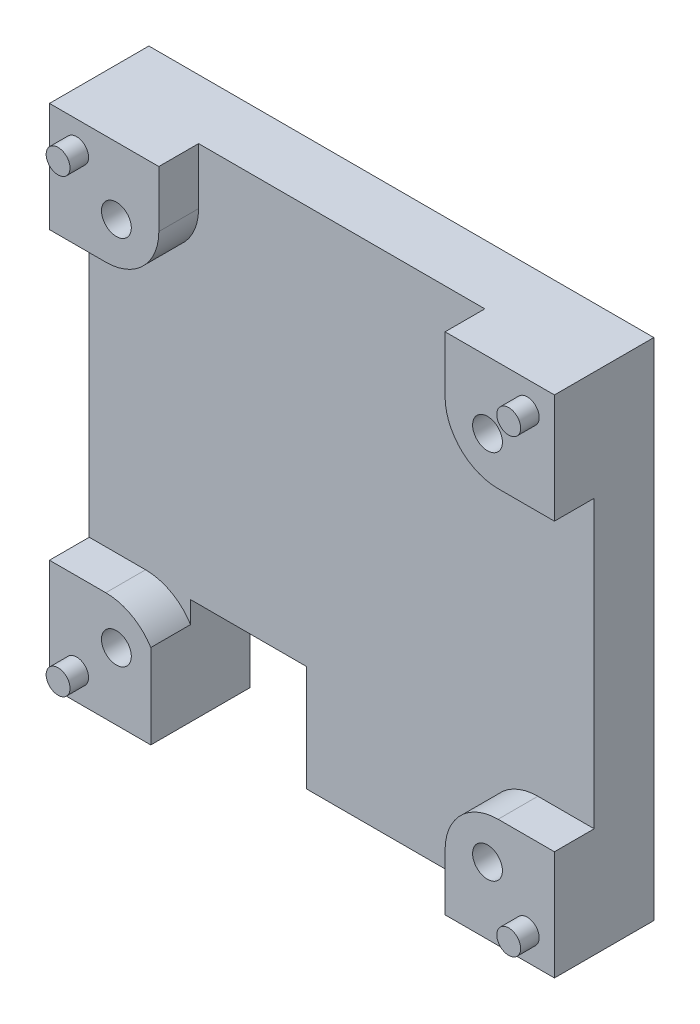
from build123d import *

# Parameters (mm, degrees)
SKETCH3_W           = 38.1
SKETCH3_H           = 38.1
SKETCH3_R           = 1.125
BOSS_EXTRUDE1_DEPTH = 4.5
BOSS_EXTRUDE2_START = 3
SKETCH2_R           = 1.125
BOSS_EXTRUDE2_DEPTH = 3
SKETCH4_W           = 8.75
SKETCH4_H           = 5.25
CUT_EXTRUDE1_DEPTH  = 10
SKETCH6_W           = 8.75
SKETCH6_H           = 2.75
CUT_EXTRUDE2_DEPTH  = 10
SKETCH7_R           = 0.9
BOSS_EXTRUDE3_DEPTH = 1.4


with BuildPart() as part:
    # Sketch3 → Boss-Extrude1 (new body)
    with BuildSketch(Plane.XY):
        with Locations((0.466348003, 11.564505911)):
            Rectangle(SKETCH3_W, SKETCH3_H)
        with Locations((-13.533651997, 25.564505911)):
            Circle(SKETCH3_R, mode=Mode.SUBTRACT)
        with Locations((14.466348003, 25.564505911)):
            Circle(SKETCH3_R, mode=Mode.SUBTRACT)
        with Locations((14.466348003, -2.435494089)):
            Circle(SKETCH3_R, mode=Mode.SUBTRACT)
        with Locations((-13.533651997, -2.435494089)):
            Circle(SKETCH3_R, mode=Mode.SUBTRACT)
    extrude(amount=-BOSS_EXTRUDE1_DEPTH)

    # Sketch2 → Boss-Extrude2 (add)
    # profile 1 of 4: a face of its own
    with BuildSketch(Plane.XY.offset(BOSS_EXTRUDE2_START)):
        with BuildLine():
            Line((-18.583651997, 30.614505911), (-10.333651997, 30.614505911))
            Line((-10.333651997, 30.614505911), (-10.333651997, 26.364505911))
            ThreePointArc((-10.333651997, 26.364505911), (-11.505224872, 23.536078787), (-14.333651997, 22.364505911))
            Line((-14.333651997, 22.364505911), (-18.583651997, 22.364505911))
            Line((-18.583651997, 22.364505911), (-18.583651997, 30.614505911))
        make_face()
        with Locations((-13.533651997, 25.564505911)):
            Circle(SKETCH2_R, mode=Mode.SUBTRACT)
    # profile 2 of 4: a face of its own
    with BuildSketch(Plane.XY.offset(BOSS_EXTRUDE2_START)):
        with BuildLine():
            Line((19.516348003, 30.614505911), (11.266348003, 30.614505911))
            Line((11.266348003, 30.614505911), (11.266348003, 26.364505911))
            ThreePointArc((11.266348003, 26.364505911), (12.437920878, 23.536078787), (15.266348003, 22.364505911))
            Line((15.266348003, 22.364505911), (19.516348003, 22.364505911))
            Line((19.516348003, 22.364505911), (19.516348003, 30.614505911))
        make_face()
        with Locations((14.466348003, 25.564505911)):
            Circle(SKETCH2_R, mode=Mode.SUBTRACT)
    # profile 3 of 4: a face of its own
    with BuildSketch(Plane.XY.offset(BOSS_EXTRUDE2_START)):
        with BuildLine():
            Line((19.516348003, -7.485494089), (11.266348003, -7.485494089))
            Line((11.266348003, -7.485494089), (11.266348003, -3.235494089))
            ThreePointArc((11.266348003, -3.235494089), (12.437920878, -0.407066964), (15.266348003, 0.764505911))
            Line((15.266348003, 0.764505911), (19.516348003, 0.764505911))
            Line((19.516348003, 0.764505911), (19.516348003, -7.485494089))
        make_face()
        with Locations((14.466348003, -2.435494089)):
            Circle(SKETCH2_R, mode=Mode.SUBTRACT)
    # profile 4 of 4: a face of its own
    with BuildSketch(Plane.XY.offset(BOSS_EXTRUDE2_START)):
        with BuildLine():
            Line((-18.583651997, -7.485494089), (-10.333651997, -7.485494089))
            Line((-10.333651997, -7.485494089), (-10.333651997, -3.235494089))
            ThreePointArc((-10.333651997, -3.235494089), (-11.505224872, -0.407066964), (-14.333651997, 0.764505911))
            Line((-14.333651997, 0.764505911), (-18.583651997, 0.764505911))
            Line((-18.583651997, 0.764505911), (-18.583651997, -7.485494089))
        make_face()
        with Locations((-13.533651997, -2.435494089)):
            Circle(SKETCH2_R, mode=Mode.SUBTRACT)
    extrude(amount=-BOSS_EXTRUDE2_DEPTH)

    # Sketch4 → Cut-Extrude1 (cut)
    with BuildSketch(Plane(origin=(0, 0, -4.5), x_dir=(-1, 0, 0), z_dir=(0, 0, -1))):
        with Locations((6.563651997, -2.110494089)):
            Rectangle(SKETCH4_W, SKETCH4_H)
    extrude(amount=-CUT_EXTRUDE1_DEPTH, mode=Mode.SUBTRACT)

    # Sketch6 → Cut-Extrude2 (cut)
    with BuildSketch(Plane(origin=(0, 0, -4.5), x_dir=(-1, 0, 0), z_dir=(0, 0, -1))):
        with Locations((6.563651997, -6.110494089)):
            Rectangle(SKETCH6_W, SKETCH6_H)
    extrude(amount=-CUT_EXTRUDE2_DEPTH, mode=Mode.SUBTRACT)

    # Sketch7 → Boss-Extrude3 (add)
    with BuildSketch(Plane.XY.offset(3)):
        with Locations((-16.533651997, 28.564505911)):
            Circle(SKETCH7_R)
        with Locations((17.466348003, 28.564505911)):
            Circle(SKETCH7_R)
        with Locations((17.466348003, -5.435494089)):
            Circle(SKETCH7_R)
        with Locations((-16.533651997, -5.435494089)):
            Circle(SKETCH7_R)
    extrude(amount=BOSS_EXTRUDE3_DEPTH)


solid = part.part
